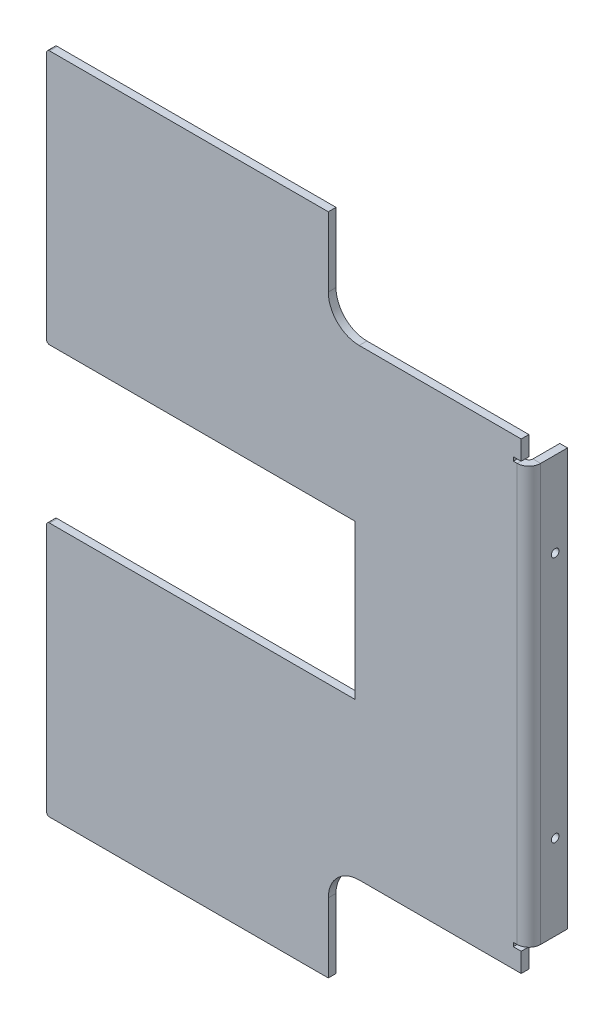
from build123d import *

# Parameters (mm, degrees)
BASE_FLANGE1_DEPTH            = 5
EDGE_FLANGE1_STRIP_W          = 25.2
EDGE_FLANGE1_STRIP_H          = 5
EDGE_FLANGE1_STRIP_CUT_DEPTH  = 270
EDGE_FLANGE1_RELIEF_W         = 27.7
EDGE_FLANGE1_RELIEF_H         = 2.5
EDGE_FLANGE1_RELIEF_CUT_DEPTH = 5
EDGE_FLANGE1_DEPTH            = 270
SKETCH9_R                     = 2.5
CUT_EXTRUDE1_DEPTH            = 10
FILLET1_R                     = 20
FILLET2_R                     = 2


# Sheet-metal steps are written as plain solids
with BuildPart() as part:
    # Sketch1 → Base-Flange1 (new body)
    with BuildSketch(Plane.XY):
        Polygon((28.8, 215), (-153.8, 215), (-153.8, 50), (46.2, 50), (46.2, -50), (-153.8, -50), (-153.8, -215), (28.8, -215), (28.8, -150), (153.8, -150), (153.8, 150), (28.8, 150), align=None)
    extrude(amount=-BASE_FLANGE1_DEPTH)

    # Edge-Flange1 strip (across the edge) → Edge-Flange1 strip cut (cut)
    with BuildSketch(Plane(origin=(153.8, 135, -5), x_dir=(-1, 0, 0), z_dir=(0, -1, 0))):
        with Locations((-10, -2.5)):
            Rectangle(EDGE_FLANGE1_STRIP_W, EDGE_FLANGE1_STRIP_H)
    extrude(amount=EDGE_FLANGE1_STRIP_CUT_DEPTH, mode=Mode.SUBTRACT)

    # Edge-Flange1 relief (on the sheet) → Edge-Flange1 relief cut (cut)
    with BuildSketch(Plane(origin=(151.2, 135, -5), x_dir=(-1, 0, 0), z_dir=(0, 0, -1))):
        with Locations((-11.35, 1.25)):
            Rectangle(EDGE_FLANGE1_RELIEF_W, EDGE_FLANGE1_RELIEF_H)
        with Locations((-11.35, -271.25)):
            Rectangle(EDGE_FLANGE1_RELIEF_W, EDGE_FLANGE1_RELIEF_H)
    extrude(amount=-EDGE_FLANGE1_RELIEF_CUT_DEPTH, mode=Mode.SUBTRACT)

    # Edge-Flange1 section (across the edge) → Edge-Flange1 (add)
    with BuildSketch(Plane(origin=(153.8, 135, -5), x_dir=(-1, 0, 0), z_dir=(0, -1, 0))):
        with BuildLine():
            Line((-5, 2.6), (-5, 20))
            Line((-5, 20), (0, 20))
            Line((0, 20), (0, 2.6))
            ThreePointArc((0, 2.6), (0.761522369, 0.761522369), (2.6, 0))
            Line((2.6, 0), (2.6, -5))
            ThreePointArc((2.6, -5), (-2.774011537, -2.774011537), (-5, 2.6))
        make_face()
    extrude(amount=EDGE_FLANGE1_DEPTH)

    # Sketch9 → Cut-Extrude1 (cut)
    with BuildSketch(Plane(origin=(158.8, 0, 0), x_dir=(0, 0, -1), z_dir=(1, 0, 0))):
        with Locations((17, 80)):
            Circle(SKETCH9_R)
        with Locations((17, -80)):
            Circle(SKETCH9_R)
    extrude(amount=-CUT_EXTRUDE1_DEPTH, mode=Mode.SUBTRACT)

    # Fillet1
    fillet1_edges = [part.edges().sort_by_distance(p)[0] for p in [
        (28.8, 150, -2.5),
        (28.8, -150, -2.5),
    ]]
    fillet(fillet1_edges, radius=FILLET1_R)

    # Fillet2
    fillet2_edges = [part.edges().sort_by_distance(p)[0] for p in [
        (-153.8, -50, -2.5),
        (-153.8, 50, -2.5),
        (-153.8, 215, -2.5),
        (-153.8, -215, -2.5),
    ]]
    fillet(fillet2_edges, radius=FILLET2_R)


solid = part.part
